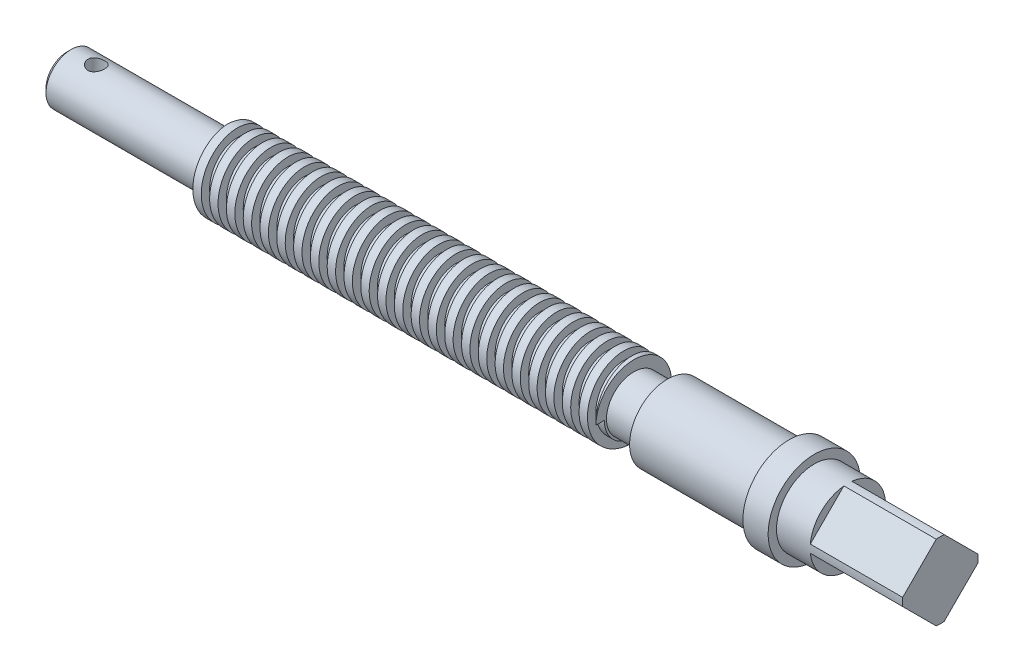
from build123d import *

# Parameters (mm, degrees)
CHAMFER_1_SIZE           = 1
SKETCH_2_OUTSIDE_W       = 66.062
SKETCH_2_OUTSIDE_H       = 66.062
CUT_EXTRUDE_1_DEPTH      = 22
CUT_EXTRUDE_2_DEPTH      = 209.580919549
CUT_EXTRUDE_2_DEPTH_BACK = 209.580919549
SKETCH_3_R               = 2
SWEEP_1_PITCH            = 4


with BuildPart() as part:
    # 草图1 → 旋转1 (revolve)
    with BuildSketch(Plane.XY, mode=Mode.PRIVATE) as revolve_1_sk:
        Polygon((0, 0), (0, 6), (38, 6), (38, 9), (135, 9), (135, 6.5), (143, 6.5), (143, 9), (172, 9), (172, 11), (178, 11), (178, 9), (208, 9), (208, 0), align=None)
    revolve(revolve_1_sk.sketch.rotate(Axis((-61.686146992, 0, 0), (1, 0, 0)), 90), axis=Axis((-61.686146992, 0, 0), (1, 0, 0)))

    # 倒角1
    chamfer_1_edges = [part.edges().sort_by_distance(p)[0] for p in [
        (0, 0, -6),
    ]]
    chamfer(chamfer_1_edges, length=CHAMFER_1_SIZE)

    # 草图2 outside → 切除-拉伸1 (cut)
    with BuildSketch(Plane(origin=(208, 0, 0), x_dir=(0, 0, -1), z_dir=(1, 0, 0))):
        Rectangle(SKETCH_2_OUTSIDE_W, SKETCH_2_OUTSIDE_H)
        Polygon((-9.899494937, 0), (0, 9.899494937), (9.899494937, 0), (0, -9.899494937), align=None, mode=Mode.SUBTRACT)
    extrude(amount=-CUT_EXTRUDE_1_DEPTH, mode=Mode.SUBTRACT)

    # 草图3 → 切除-拉伸2 (cut, two sides: drawn at the far end of the back side and taken through both)
    with BuildSketch(Plane(origin=(0, 0, 0), x_dir=(1, 0, 0), z_dir=(0, 1, 0)).offset(-CUT_EXTRUDE_2_DEPTH_BACK)):
        with Locations(Location((7, 0, 0), (0, 0, 270))):
            Circle(SKETCH_3_R)
    extrude(amount=CUT_EXTRUDE_2_DEPTH + CUT_EXTRUDE_2_DEPTH_BACK, mode=Mode.SUBTRACT)

    # 切除-扫描1: arcs per turn and ends read off the stored shape
    # 切除-扫描1: the profile of 草图5 profile screwed along a right-hand helix through 26 turns, 12 arcs to a turn; built about Z, then put on its axis
    sweep_1_z = Axis((0, 0, 0), (0, 0, 1))
    sweep_1_corners = [(7, 0, -5), (9.0003, 0, -5), (9.0003, 0, -3), (7, 0, -3)]
    with BuildLine(mode=Mode.PRIVATE) as sweep_1_profile:
        Line(sweep_1_corners[0], sweep_1_corners[1])
        Line(sweep_1_corners[1], sweep_1_corners[2])
        Line(sweep_1_corners[2], sweep_1_corners[3])
        Line(sweep_1_corners[3], sweep_1_corners[0])
    sweep_1_cap = Face(sweep_1_profile.wire())
    sweep_1_turn_angles = [0, 15, 30, 45, 60, 75, 90, 105, 120, 135, 150, 165, 180, 195, 210, 225, 240, 255, 270, 285, 300, 315, 330, 345, 360]
    sweep_1_turn_weights = [1, 0.9659258262890683, 1, 0.9659258262890683, 1, 0.9659258262890683, 1, 0.9659258262890683, 1, 0.9659258262890683, 1, 0.9659258262890683, 1, 0.9659258262890683, 1, 0.9659258262890683, 1, 0.9659258262890683, 1, 0.9659258262890683, 1, 0.9659258262890683, 1, 0.9659258262890683, 1]
    sweep_1_turn_rails = [Edge.make_bspline([Vector(p[0], p[1], 0).rotate(sweep_1_z, sweep_1_turn_angles[k]) / sweep_1_turn_weights[k] + Vector(0, 0, p[2] + SWEEP_1_PITCH * sweep_1_turn_angles[k] / 360) for k in range(25)], [0, 0, 0, 1, 1, 2, 2, 3, 3, 4, 4, 5, 5, 6, 6, 7, 7, 8, 8, 9, 9, 10, 10, 11, 11, 12, 12, 12], 2, sweep_1_turn_weights) for p in sweep_1_corners]
    sweep_1_turn_sides = [Face.make_surface_from_curves(sweep_1_turn_rails[p[0]], sweep_1_turn_rails[p[1]]) for p in [(0, 1), (1, 2), (2, 3), (3, 0)]]
    sweep_1 = Plane(origin=(38, 0, 0), x_dir=(0, 0, 1), z_dir=(1, 0, 0)) * Solid(Shell([*[p.moved(Location((0, 0, SWEEP_1_PITCH * i))) for i in range(26) for p in sweep_1_turn_sides], sweep_1_cap, sweep_1_cap.rotate(sweep_1_z, 9360).moved(Location((0, 0, SWEEP_1_PITCH * 9360 / 360)))]))
    add(sweep_1, mode=Mode.SUBTRACT)


solid = part.part
